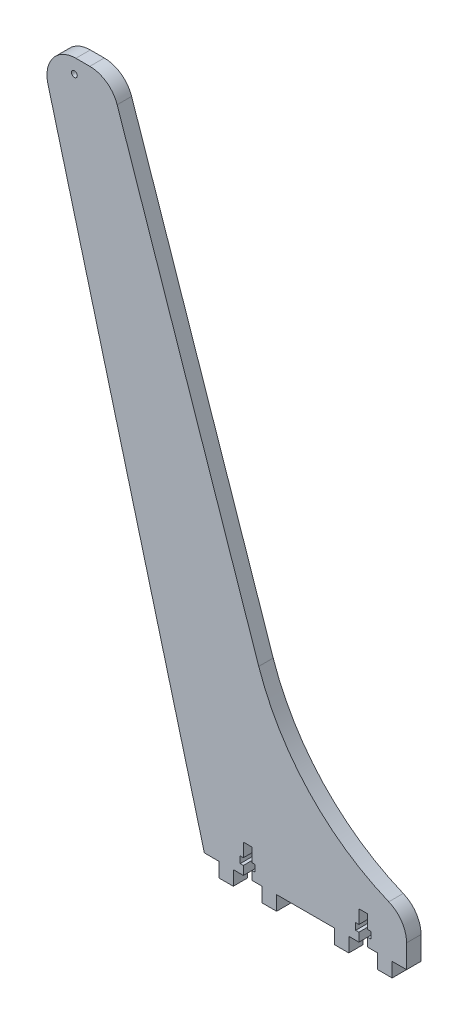
from build123d import *

# Parameters (mm, degrees)
BOSS_EXTRU_1_OUTLINE_R = 1
BOSS_EXTRU_1_DEPTH     = 5
CONG_1_R               = 10


# Read off the part's stored shape, not the designer's step: Boss.-Extru.1
with BuildPart() as part:
    # Boss.-Extru.1 outline → Boss.-Extru.1 (new body)
    with BuildSketch(Plane.XY):
        with BuildLine():
            Line((-67.5, 216), (-92.5, 216))
            Line((-92.5, 216), (-35, 0))
            Line((-35, 0), (-30, 0))
            Line((-30, 0), (-30, -5))
            Line((-30, -5), (-25, -5))
            Line((-25, -5), (-25, 0))
            Line((-25, 0), (-21.5, 0))
            Line((-21.5, 0), (-21.5, 3))
            Line((-21.5, 3), (-22.6, 3))
            Line((-22.6, 3), (-22.6, 5.3))
            Line((-22.6, 5.3), (-21.5, 5.3))
            Line((-21.5, 5.3), (-21.5, 10))
            Line((-21.5, 10), (-18.5, 10))
            Line((-18.5, 10), (-18.5, 5.3))
            Line((-18.5, 5.3), (-17.4, 5.3))
            Line((-17.4, 5.3), (-17.4, 3))
            Line((-17.4, 3), (-18.5, 3))
            Line((-18.5, 3), (-18.5, 0))
            Line((-18.5, 0), (-15, 0))
            Line((-15, 0), (-15, -5))
            Line((-15, -5), (-10, -5))
            Line((-10, -5), (-10, 0))
            Line((-10, 0), (10, 0))
            Line((10, 0), (10, -5))
            Line((10, -5), (15, -5))
            Line((15, -5), (15, 0))
            Line((15, 0), (18.5, 0))
            Line((18.5, 0), (18.5, 3))
            Line((18.5, 3), (17.4, 3))
            Line((17.4, 3), (17.4, 5.3))
            Line((17.4, 5.3), (18.5, 5.3))
            Line((18.5, 5.3), (18.5, 10))
            Line((18.5, 10), (21.5, 10))
            Line((21.5, 10), (21.5, 5.3))
            Line((21.5, 5.3), (22.6, 5.3))
            Line((22.6, 5.3), (22.6, 3))
            Line((22.6, 3), (21.5, 3))
            Line((21.5, 3), (21.5, 0))
            Line((21.5, 0), (25, 0))
            Line((25, 0), (25, -5))
            Line((25, -5), (30, -5))
            Line((30, -5), (30, 0))
            Line((30, 0), (35, 0))
            Line((35, 0), (35, 15))
            ThreePointArc((35, 15), (3.448702598, 34.108667771), (-16.175379452, 65.341998613))
            Line((-16.175379452, 65.341998613), (-67.5, 216))
        make_face()
        with Locations((-80, 211)):
            Circle(BOSS_EXTRU_1_OUTLINE_R, mode=Mode.SUBTRACT)
    extrude(amount=BOSS_EXTRU_1_DEPTH)

    # Congé1
    cong_1_edges = [part.edges().sort_by_distance(p)[0] for p in [
        (-67.5, 216, 2.5),
        (35, 15, 2.5),
        (-92.5, 216, 2.5),
    ]]
    fillet(cong_1_edges, radius=CONG_1_R)


solid = part.part
